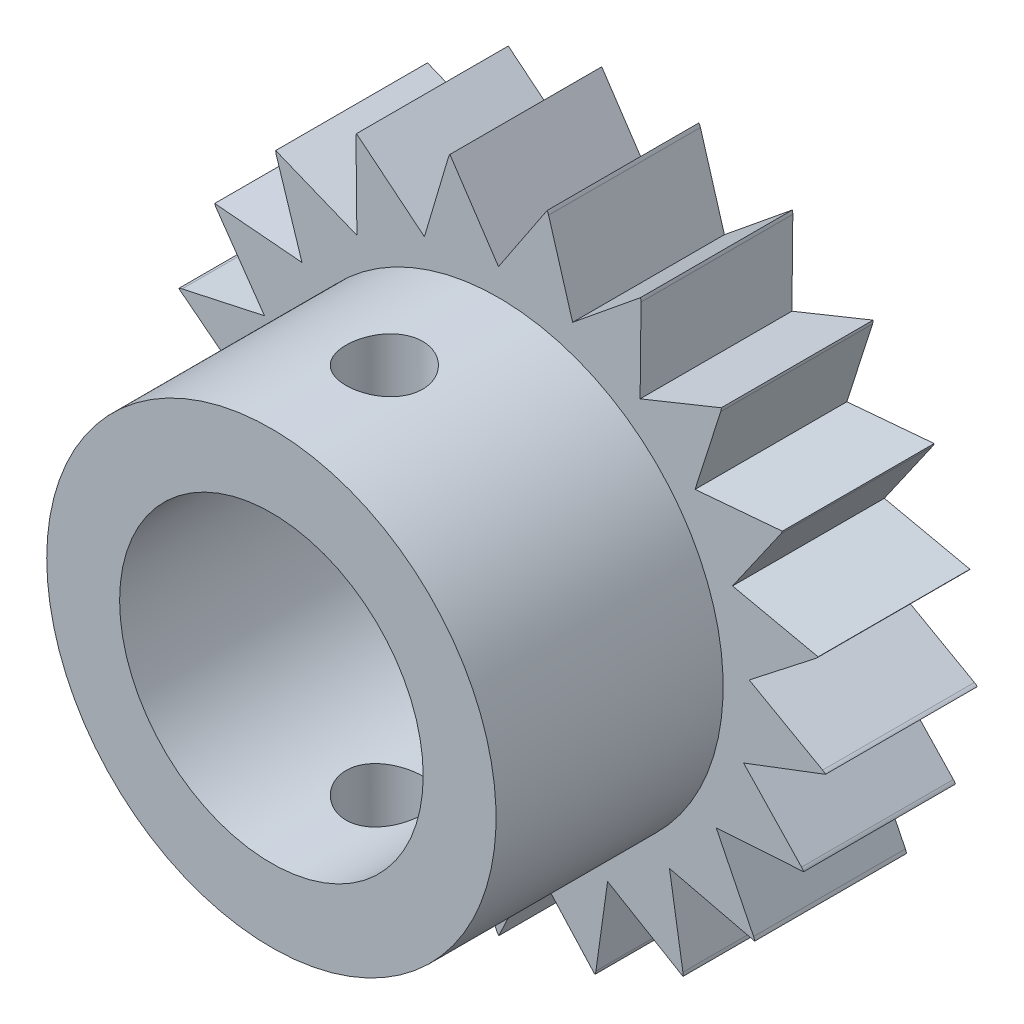
from build123d import *

# Parameters (mm, degrees)
CUT_EXTRUDE5_DEPTH      = 11.799302202
CUT_EXTRUDE5_DEPTH_BACK = 11.799302202
FILLET1_R               = 0.254
CUT_EXTRUDE4_DEPTH      = 13.513900808
CUT_EXTRUDE4_DEPTH_BACK = 13.513900808
SKETCH4_R               = 0.8001


with BuildPart() as part:
    # Sketch2 → Revolve1 (revolve)
    with BuildSketch(Plane(origin=(0, 0, 0), x_dir=(0, 0, -1), z_dir=(1, 0, 0)), mode=Mode.PRIVATE) as revolve1_sk:
        Polygon((0, 3.175), (0, 6.858), (-3.175, 6.858), (-3.175, 4.699), (-7.9248, 4.699), (-7.9248, 3.175), align=None)
    revolve(revolve1_sk.sketch.rotate(Axis((0, 0, -6.785443847), (0, 0, 1)), 90), axis=Axis((0, 0, -6.785443847), (0, 0, 1)))

    # Sketch5 → Cut-Extrude5 (cut, two sides: drawn at the far end of the back side and taken through both)
    with BuildSketch(Plane.XY.offset(3.175).offset(-CUT_EXTRUDE5_DEPTH_BACK)):
        with BuildLine():
            Line((-1.549763756, 5.024210698), (-1.028262887, 6.780474868))
            ThreePointArc((-1.028262887, 6.780474868), (-2.021430986, 6.553318302), (-2.969986829, 6.181532354))
            Line((-2.969986829, 6.181532354), (-1.549763756, 5.024210698))
        make_face()
        with BuildLine():
            Line((-2.961824201, 4.344198228), (-2.981160105, 6.176151587))
            ThreePointArc((-2.981160105, 6.176151587), (-3.863248958, 5.666345514), (-4.660077294, 5.031485229))
            Line((-4.660077294, 5.031485229), (-2.961824201, 4.344198228))
        make_face()
        with BuildLine():
            Line((-4.110713569, 3.27818468), (-4.669168164, 5.023050135))
            ThreePointArc((-4.669168164, 5.023050135), (-5.361800307, 4.275893061), (-5.936099441, 3.434368562))
            Line((-5.936099441, 3.434368562), (-4.110713569, 3.27818468))
        make_face()
        with BuildLine():
            Line((-4.894347996, 1.920890038), (-5.942300142, 3.423628634))
            ThreePointArc((-5.942300142, 3.423628634), (-6.383932168, 2.505508745), (-6.684673103, 1.532093177))
            Line((-6.684673103, 1.532093177), (-4.894347996, 1.920890038))
        make_face()
        with BuildLine():
            Line((-5.243098125, 0.392915886), (-6.687432674, 1.520002705))
            ThreePointArc((-6.687432674, 1.520002705), (-6.838823641, 0.512498982), (-6.839284225, -0.50631541))
            Line((-6.839284225, -0.50631541), (-5.243098125, 0.392915886))
        make_face()
        with BuildLine():
            Line((-5.125975977, -1.169970567), (-6.838357467, -0.518682134))
            ThreePointArc((-6.838357467, -0.518682134), (-6.686055622, -1.526048565), (-6.386194929, -2.499735652))
            Line((-6.386194929, -2.499735652), (-5.125975977, -1.169970567))
        make_face()
        with BuildLine():
            Line((-4.553388368, -2.6289), (-6.381664189, -2.51127979))
            ThreePointArc((-6.381664189, -2.51127979), (-5.939202219, -3.429), (-5.365664189, -4.271043411))
            Line((-5.365664189, -4.271043411), (-4.553388368, -2.6289))
        make_face()
        with BuildLine():
            Line((-3.576212221, -3.854240132), (-5.357932042, -4.280739216))
            ThreePointArc((-5.357932042, -4.280739216), (-4.664624636, -5.027269737), (-3.868370638, -5.662850219))
            Line((-3.868370638, -5.662850219), (-3.576212221, -3.854240132))
        make_face()
        with BuildLine():
            Line((-2.281273924, -4.737114114), (-3.85812412, -5.669836177))
            ThreePointArc((-3.85812412, -5.669836177), (-2.975574683, -6.178844496), (-2.02735538, -6.551487935))
            Line((-2.02735538, -6.551487935), (-2.281273924, -4.737114114))
        make_face()
        with BuildLine():
            Line((-0.783634427, -5.199074718), (-2.015504939, -6.555143312))
            ThreePointArc((-2.015504939, -6.555143312), (-1.022131861, -6.781401806), (-0.0062007, -6.857997197))
            Line((-0.0062007, -6.857997197), (-0.783634427, -5.199074718))
        make_face()
        with BuildLine():
            ThreePointArc((0.0062007, -6.857997197), (1.022131861, -6.781401806), (2.015504939, -6.555143312))
            Line((2.015504939, -6.555143312), (0.783634427, -5.199074718))
            Line((0.783634427, -5.199074718), (0.0062007, -6.857997197))
        make_face()
        with BuildLine():
            ThreePointArc((2.02735538, -6.551487935), (2.975574683, -6.178844496), (3.85812412, -5.669836177))
            Line((3.85812412, -5.669836177), (2.281273924, -4.737114114))
            Line((2.281273924, -4.737114114), (2.02735538, -6.551487935))
        make_face()
        with BuildLine():
            ThreePointArc((3.868370638, -5.662850219), (4.664624636, -5.027269737), (5.357932042, -4.280739216))
            Line((5.357932042, -4.280739216), (3.576212221, -3.854240132))
            Line((3.576212221, -3.854240132), (3.868370638, -5.662850219))
        make_face()
        with BuildLine():
            ThreePointArc((5.365664189, -4.271043411), (5.939202219, -3.429), (6.381664189, -2.51127979))
            Line((6.381664189, -2.51127979), (4.553388368, -2.6289))
            Line((4.553388368, -2.6289), (5.365664189, -4.271043411))
        make_face()
        with BuildLine():
            ThreePointArc((6.386194929, -2.499735652), (6.686055622, -1.526048565), (6.838357467, -0.518682134))
            Line((6.838357467, -0.518682134), (5.125975977, -1.169970567))
            Line((5.125975977, -1.169970567), (6.386194929, -2.499735652))
        make_face()
        with BuildLine():
            ThreePointArc((6.858, 0), (6.815224768, 0.764771443), (6.687432674, 1.520002705))
            Line((6.687432674, 1.520002705), (5.243098125, 0.392915886))
            Line((5.243098125, 0.392915886), (6.839284225, -0.50631541))
            ThreePointArc((6.839284225, -0.50631541), (6.853319459, -0.253330602), (6.858, 0))
        make_face()
        with BuildLine():
            ThreePointArc((6.684673103, 1.532093177), (6.383932168, 2.505508745), (5.942300142, 3.423628634))
            Line((5.942300142, 3.423628634), (4.894347996, 1.920890038))
            Line((4.894347996, 1.920890038), (6.684673103, 1.532093177))
        make_face()
        with BuildLine():
            ThreePointArc((5.936099441, 3.434368562), (5.361800307, 4.275893061), (4.669168164, 5.023050135))
            Line((4.669168164, 5.023050135), (4.110713569, 3.27818468))
            Line((4.110713569, 3.27818468), (5.936099441, 3.434368562))
        make_face()
        with BuildLine():
            ThreePointArc((4.660077294, 5.031485229), (3.863248958, 5.666345514), (2.981160105, 6.176151587))
            Line((2.981160105, 6.176151587), (2.961824201, 4.344198228))
            Line((2.961824201, 4.344198228), (4.660077294, 5.031485229))
        make_face()
        with BuildLine():
            ThreePointArc((2.969986829, 6.181532354), (2.021430986, 6.553318302), (1.028262887, 6.780474868))
            Line((1.028262887, 6.780474868), (1.549763756, 5.024210698))
            Line((1.549763756, 5.024210698), (2.969986829, 6.181532354))
        make_face()
        with BuildLine():
            Line((0, 6.858), (0, 5.2578))
            Line((0, 5.2578), (1.016, 6.782323201))
            ThreePointArc((1.016, 6.782323201), (0.509407248, 6.839054632), (0, 6.858))
        make_face()
        with BuildLine():
            Line((-1.016, 6.782323201), (0, 5.2578))
            Line((0, 5.2578), (0, 6.858))
            ThreePointArc((0, 6.858), (-0.509407248, 6.839054632), (-1.016, 6.782323201))
        make_face()
    extrude(amount=CUT_EXTRUDE5_DEPTH + CUT_EXTRUDE5_DEPTH_BACK, mode=Mode.SUBTRACT)

    # Fillet1
    # the kernel refuses this fillet: 0.254 mm, written as the material it takes off along each edge
    with BuildSketch(Plane(origin=(1.028262887, 6.780474868, -0.173566316), x_dir=(0.2846534382375399, -0.958630491951694, 0), z_dir=(0, 0, 1)), Plane(origin=(2.981160105, 6.176151587, -0.173566316), x_dir=(-0.010554213197513457, -0.9999443027407983, 0), z_dir=(0, 0, 1)), Plane(origin=(4.669168164, 5.023050135, -0.173566316), x_dir=(-0.3048240764735684, -0.9524086740480875, 0), z_dir=(0, 0, 1)), Plane(origin=(5.942300142, 3.423628634, -0.173566316), x_dir=(-0.5720089828565192, -0.8202473550895794, 0), z_dir=(0, 0, 1))) as fillet1_piece_1:
        with BuildLine():
            CenterArc((0.069426526, -0.254), FILLET1_R, 90, 17.100666737)
            Line((-0.005262541, -0.011229443), (-0.006756323, -0.006374032))
            ThreePointArc((-0.006756323, -0.006374032), (-0.007233739, -0.003457831), (-0.004597979, 0.002159859))
            Line((-0.004597979, 0.002159859), (0, 0.00508))
            Line((0, 0.00508), (0.069426526, 0.00508))
            Line((0.069426526, 0.00508), (0.069426526, 0))
        make_face()
    extrude(amount=3.522132632, mode=Mode.SUBTRACT)
    with BuildSketch(Plane(origin=(6.687432674, 1.520002705, 3.348566316), x_dir=(-0.7883683808925953, -0.6152034590351292, 0), z_dir=(0, 0, -1)), Plane(origin=(-0.0062007, -6.857997197, 3.348566316), x_dir=(-0.4243505554663044, 0.9054979878914358, 0), z_dir=(0, 0, -1)), Plane(origin=(-2.02735538, -6.551487935, 3.348566316), x_dir=(-0.13859763357417676, 0.9903487749109595, 0), z_dir=(0, 0, -1)), Plane(origin=(-3.868370638, -5.662850219, 3.348566316), x_dir=(0.15947029628670847, 0.9872027272056279, 0), z_dir=(0, 0, -1)), Plane(origin=(-5.365664189, -4.271043411, 3.348566316), x_dir=(0.4433685904986441, 0.8963393849202688, 0), z_dir=(0, 0, -1)), Plane(origin=(-6.386194929, -2.499735652, 3.348566316), x_dir=(0.687871639753785, 0.7258323547641282, 0), z_dir=(0, 0, -1)), Plane(origin=(-6.684673103, 1.532093177, 3.348566316), x_dir=(0.9772221447470836, 0.21221894311279188, 0), z_dir=(0, 0, -1))) as fillet1_piece_2:
        with BuildLine():
            CenterArc((0.069426526, 0.254), FILLET1_R, 252.899333263, 17.100666737)
            Line((-0.005262541, 0.011229443), (-0.006756323, 0.006374032))
            ThreePointArc((-0.006756323, 0.006374032), (-0.007233739, 0.003457831), (-0.004597979, -0.002159859))
            Line((-0.004597979, -0.002159859), (0, -0.00508))
            Line((0, -0.00508), (0.069426526, -0.00508))
            Line((0.069426526, -0.00508), (0.069426526, 0))
        make_face()
    extrude(amount=3.522132632, mode=Mode.SUBTRACT)
    with BuildSketch(Plane(origin=(6.839284225, -0.50631541, 3.348566316), x_dir=(-0.07473009358640008, -0.9972037971811819, 0), z_dir=(0, 0, -1)), Plane(origin=(6.386194929, -2.499735652, 3.348566316), x_dir=(-0.3653410243663928, -0.9308737486442051, 0), z_dir=(0, 0, -1)), Plane(origin=(5.365664189, -4.271043411, 3.348566316), x_dir=(-0.623489801858665, -0.7818314824680845, 0), z_dir=(0, 0, -1)), Plane(origin=(3.868370638, -5.662850219, 3.348566316), x_dir=(-0.8262387743159489, -0.5633200580636893, 0), z_dir=(0, 0, -1)), Plane(origin=(2.02735538, -6.551487935, 3.348566316), x_dir=(-0.9555728057861146, -0.2947551744109893, 0), z_dir=(0, 0, -1)), Plane(origin=(-1.028262887, 6.780474868, 3.348566316), x_dir=(0.9888308262251171, 0.14904226617625063, 0), z_dir=(0, 0, -1)), Plane(origin=(-2.981160105, 6.176151587, 3.348566316), x_dir=(0.9009688679024408, 0.4338837391175129, 0), z_dir=(0, 0, -1)), Plane(origin=(-4.669168164, 5.023050135, 3.348566316), x_dir=(0.7330518718297447, 0.6801727377710072, 0), z_dir=(0, 0, -1)), Plane(origin=(-5.942300142, 3.423628634, 3.348566316), x_dir=(0.50000000000004, 0.8660254037844156, 0), z_dir=(0, 0, -1))) as fillet1_piece_3:
        with BuildLine():
            CenterArc((0.200535304, 0.170650621), FILLET1_R, 205.109562615, 17.100666737)
            Line((-0.029461185, 0.06286558), (-0.034061115, 0.060709879))
            Line((-0.034061115, 0.060709879), (-0.00459993, -0.002155701))
            Line((-0.00459993, -0.002155701), (-4.593e-06, -0.005079998))
            ThreePointArc((-4.593e-06, -0.005079998), (0.0062007, -0.005082803), (0.008638723, -0.003413012))
            Line((0.008638723, -0.003413012), (0.012401401, 0))
        make_face()
    extrude(amount=3.522132632, mode=Mode.SUBTRACT)
    with BuildSketch(Plane(origin=(-6.839284225, -0.50631541, 3.348566316), x_dir=(0.07473009358634887, -0.9972037971811858, 0), z_dir=(0, 0, -1))) as fillet1_piece_4:
        with BuildLine():
            CenterArc((0.200535304, -0.170650621), FILLET1_R, 137.789770648, 17.100666737)
            Line((-0.029461185, -0.06286558), (-0.034061115, -0.060709879))
            Line((-0.034061115, -0.060709879), (-0.00459993, 0.002155701))
            Line((-0.00459993, 0.002155701), (-4.593e-06, 0.005079998))
            ThreePointArc((-4.593e-06, 0.005079998), (0.0062007, 0.005082803), (0.008638723, 0.003413012))
            Line((0.008638723, 0.003413012), (0.012401401, 0))
        make_face()
    extrude(amount=3.522132632, mode=Mode.SUBTRACT)

    # Sketch4 → Cut-Extrude4 (cut, two sides: drawn at the far end of the back side and taken through both)
    with BuildSketch(Plane(origin=(0, 0, 0), x_dir=(1, 0, 0), z_dir=(0, 1, 0)).offset(-CUT_EXTRUDE4_DEPTH_BACK)):
        with Locations(Location((0, -5.5626, 0), (0, 0, 270))):
            Circle(SKETCH4_R)
    extrude(amount=CUT_EXTRUDE4_DEPTH + CUT_EXTRUDE4_DEPTH_BACK, mode=Mode.SUBTRACT)


solid = part.part
